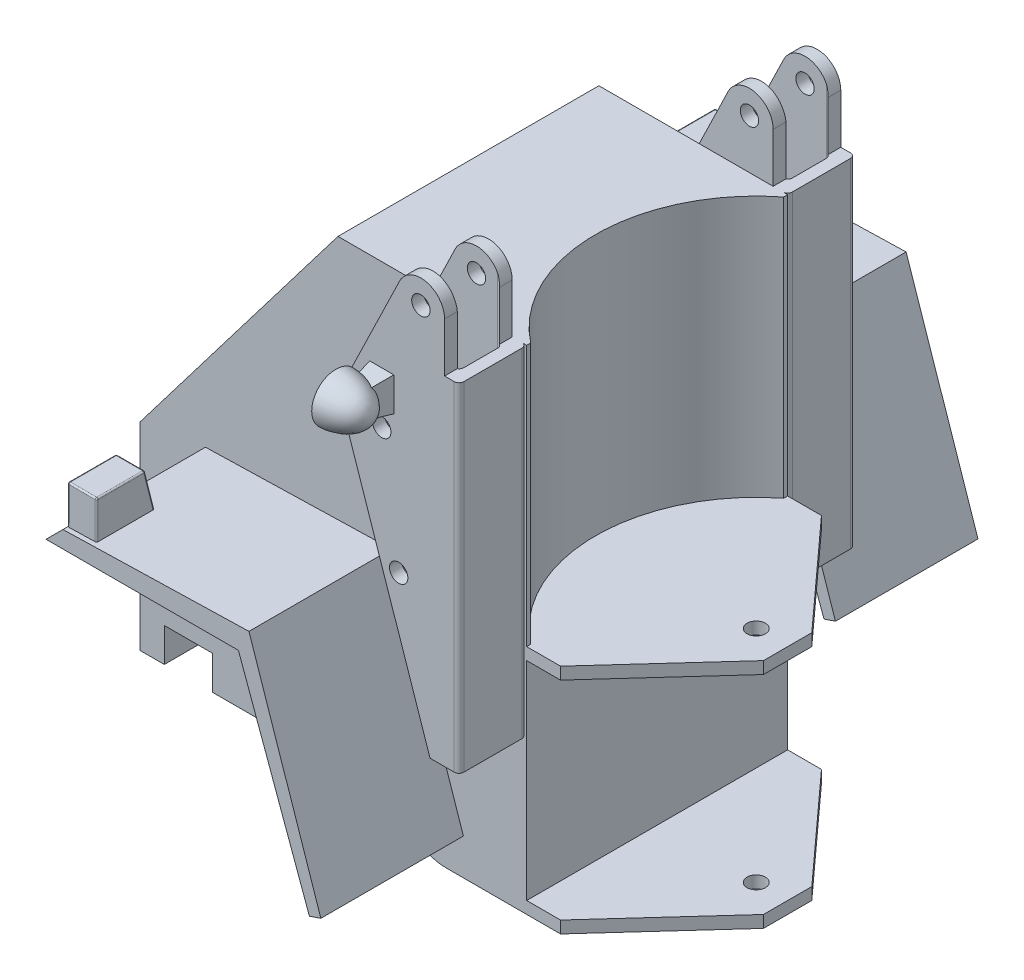
from build123d import *

# Parameters (mm, degrees)
BOSS_EXTRUDE1_DEPTH      = 13.5
SKETCH2_R                = 16.625
CUT_EXTRUDE1_DEPTH       = 27
SKETCH3_R                = 0.95
BOSS_EXTRUDE2_DEPTH      = 7
SKETCH4_W                = 10.661192755
SKETCH4_H                = 4.5
CUT_EXTRUDE2_DEPTH       = 71.961897113
SKETCH5_W                = 5
SKETCH5_H                = 3.5
CUT_EXTRUDE3_DEPTH       = 74.104998747
CUT_EXTRUDE4_REACH       = 72.962
FILLET1_R                = 10
FILLET2_R                = 0.5
CUT_EXTRUDE5_DEPTH       = 35
BOSS_EXTRUDE3_DEPTH      = 13.5
BOSS_EXTRUDE3_DEPTH_BACK = 1.25
BOSS_EXTRUDE4_DEPTH      = 3
CUT_EXTRUDE6_DEPTH       = 0.1
FILLET3_R                = 0.15
SKETCH11_W               = 2.5
SKETCH11_H               = 3.5
BOSS_EXTRUDE5_DEPTH      = 4
BOSS_EXTRUDE5_TAPER      = 10
FILLET2_OF_MIRROR5_R     = 0.5
SKETCH17_R               = 0.95
BOSS_EXTRUDE6_DEPTH      = 1.25
BOSS_EXTRUDE7_START      = -1.25
SKETCH18_R               = 0.95
BOSS_EXTRUDE7_DEPTH      = 1.25
FILLET4_R                = 5
BOSS_EXTRUDE8_REACH      = 81.293
SKETCH19_R               = 3
FILLET5_R                = 1
BOSS_EXTRUDE9_DEPTH      = 27


# Read off the part's stored shape, not the designer's step: Dome1, Dome2
with BuildPart() as part:
    # Sketch1 → Boss-Extrude1 (new, symmetric)
    with BuildSketch(Plane.XY):
        Polygon((0, 0), (0, 8), (30, 47.35), (40, 47.35), (40, -3.65), (31, -3.65), (18, 0), align=None)
    extrude(amount=BOSS_EXTRUDE1_DEPTH, both=True)

    # Sketch2 → Cut-Extrude1 (cut)
    with BuildSketch(Plane(origin=(0, 47.35, 0), x_dir=(1, 0, 0), z_dir=(0, 1, 0))):
        with Locations((50.25, 0)):
            Circle(SKETCH2_R)
    extrude(amount=-CUT_EXTRUDE1_DEPTH, mode=Mode.SUBTRACT)

    # Sketch3 → Boss-Extrude2 (add)
    with BuildSketch(Plane.XY.offset(13.5)):
        with BuildLine():
            Line((40, 47.35), (38.5, 47.35))
            Line((38.5, 47.35), (38.5, 52.462119262))
            ThreePointArc((38.5, 52.462119262), (36.598202136, 54.85), (33.845327005, 53.530724422))
            Line((33.845327005, 53.530724422), (28.839808282, 43.203680936))
            ThreePointArc((28.839808282, 43.203680936), (28.103498823, 40.401650451), (28.484133975, 37.529605301))
            Line((28.484133975, 37.529605301), (37, 12.35))
            Line((37, 12.35), (40, 12.35))
            Line((40, 12.35), (40, 47.35))
        make_face()
        with Locations((36.05, 52.462119262)):
            Circle(SKETCH3_R, mode=Mode.SUBTRACT)
        with Locations((32, 39.532440652)):
            Circle(SKETCH3_R, mode=Mode.SUBTRACT)
        with Locations((33.75, 27.35)):
            Circle(SKETCH3_R, mode=Mode.SUBTRACT)
    boss_extrude2 = extrude(amount=BOSS_EXTRUDE2_DEPTH)

    # Sketch4 → Cut-Extrude2 (cut, through all)
    with BuildSketch(Plane(origin=(0, 0, 0), x_dir=(1, 0, 0), z_dir=(0, 1, 0))):
        with Locations((33.419403622, -17)):
            Rectangle(SKETCH4_W, SKETCH4_H)
    cut_extrude2 = extrude(amount=CUT_EXTRUDE2_DEPTH, mode=Mode.SUBTRACT)

    # Sketch5 → Cut-Extrude3 (cut, through all)
    with BuildSketch(Plane.XY.offset(13.5)):
        with Locations((5, 1.75)):
            Rectangle(SKETCH5_W, SKETCH5_H)
    extrude(amount=-CUT_EXTRUDE3_DEPTH, mode=Mode.SUBTRACT)

    # Cut-Extrude4: up to this face of the body (flat: up to its plane)
    cut_extrude4_end = Plane(part.part.faces().sort_by_distance((7.5, 1.75, 0))[0])
    # Sketch6 → Cut-Extrude4 (cut, up to the picked face)
    with BuildSketch(Plane.ZY, mode=Mode.PRIVATE) as cut_extrude4_sk1:
        with BuildLine():
            Line((-7.5, 0), (7.5, 0))
            ThreePointArc((7.5, 0), (0, 7.5), (-7.5, 0))
        make_face()
    cut_extrude4_tool1 = split(extrude(cut_extrude4_sk1.sketch, amount=-CUT_EXTRUDE4_REACH, mode=Mode.PRIVATE), bisect_by=cut_extrude4_end, keep=Keep.BOTH, mode=Mode.PRIVATE)
    add(cut_extrude4_tool1.solids().sort_by(Axis((0, 3.183099, 0), (1, 0, 0)))[0], mode=Mode.SUBTRACT)

    # Fillet1
    fillet1_edges = [part.edges().sort_by_distance(p)[0] for p in [
        (5, 3.5, -6.633249581),
        (5, 3.5, 6.633249581),
    ]]
    fillet(fillet1_edges, radius=FILLET1_R)

    # Fillet2
    fillet2_edges = [part.edges().sort_by_distance(p)[0] for p in [
        (40, 29.85, 20.5),
        (38.75, 29.85, 19.25),
        (38.75, 29.85, 14.75),
    ]]
    fillet(fillet2_edges, radius=FILLET2_R)

    # Sketch7 → Cut-Extrude5 (cut)
    with BuildSketch(Plane(origin=(0, 47.35, 0), x_dir=(1, 0, 0), z_dir=(0, 1, 0))):
        with BuildLine():
            Line((39.5, -13.5), (40, -13.5))
            Line((40, -13.5), (40, -14))
            ThreePointArc((40, -14), (39.853553391, -13.646446609), (39.5, -13.5))
        make_face()
    cut_extrude5 = extrude(amount=-CUT_EXTRUDE5_DEPTH, mode=Mode.SUBTRACT)

    # Sketch11 → Boss-Extrude5 (add)
    with BuildSketch(Plane.XY.offset(20.5)):
        with Locations((32, 43.082440652)):
            Rectangle(SKETCH11_W, SKETCH11_H)
    boss_extrude5 = extrude(amount=BOSS_EXTRUDE5_DEPTH, taper=BOSS_EXTRUDE5_TAPER)

    # Sketch14 → Revolve1 (revolve)
    with BuildSketch(Plane.XZ.offset(-43.082440652)):
        with BuildLine():
            Line((30.502864053, 23.75), (34.252864053, 23.75))
            add(Edge.make_bspline(
                [(30.502864053, 21.25), (31.668412022, 21.25), (34.252864053, 21.919443705), (34.252864053, 23.75)],
                knots=[0, 0, 0, 0, 1, 1, 1, 1], degree=3))
            Line((30.502864053, 21.25), (30.502864053, 23.75))
        make_face()
    revolve1 = revolve(axis=Axis((30.502864053, 43.082440652, 23.75), (1, 0, 0)))

    # Mirror5: Boss-Extrude2 across plane
    add(boss_extrude2.mirror(Plane.XY))

    # Mirror5 2: Cut-Extrude2, Cut-Extrude5 across plane
    add(cut_extrude2.mirror(Plane.XY), mode=Mode.SUBTRACT)
    add(cut_extrude5.mirror(Plane.XY), mode=Mode.SUBTRACT)

    # Mirror5 3: Boss-Extrude5, Revolve1 across plane
    add(boss_extrude5.mirror(Plane.XY))
    add(revolve1.mirror(Plane.XY))

    # Fillet2 of Mirror5
    fillet2_of_mirror5_edges = [part.edges().sort_by_distance(p)[0] for p in [
        (40, 29.85, -20.5),
        (38.75, 29.85, -19.25),
        (38.75, 29.85, -14.75),
    ]]
    fillet(fillet2_of_mirror5_edges, radius=FILLET2_OF_MIRROR5_R)

    # Dome1 outline → Dome1 (revolve, cut)
    with BuildSketch(Plane(origin=(0, 43.082440652, 23.75), x_dir=(0, 1, 0), z_dir=(0, 0, -1))):
        with BuildLine():
            Line((0, 33.502864053), (0, 30.502864051))
            Line((0, 30.502864051), (1.999999999, 30.502864051))
            ThreePointArc((1.999999999, 30.502864051), (1.802775638, 32.538047811), (0, 33.502864053))
        make_face()
    revolve(axis=Axis((0, 43.082440652, 23.75), (1, 0, 0)), mode=Mode.SUBTRACT)

    # Dome2 outline → Dome2 (revolve, cut)
    with BuildSketch(Plane(origin=(0, 43.082440652, -23.75), x_dir=(0, 1, 0), z_dir=(0, 0, -1))):
        with BuildLine():
            Line((0, 33.502864053), (0, 30.502864051))
            Line((0, 30.502864051), (1.999999999, 30.502864051))
            ThreePointArc((1.999999999, 30.502864051), (1.802775638, 32.538047811), (0, 33.502864053))
        make_face()
    revolve(axis=Axis((0, 43.082440652, -23.75), (1, 0, 0)), mode=Mode.SUBTRACT)


with BuildPart() as body_2:
    # Sketch8 → Boss-Extrude3 (new, two sides: drawn at the far end of the back side and taken through both)
    with BuildSketch(Plane.XY.offset(20.5).offset(-BOSS_EXTRUDE3_DEPTH_BACK)):
        Polygon((31.757823968, 27.85), (12.507823968, 27.35), (10.757823968, 25.6), (30.668099233, 25.6), (38.014219672, 5.449527442), (39.198331884, 5.85), align=None)
    extrude(amount=BOSS_EXTRUDE3_DEPTH + BOSS_EXTRUDE3_DEPTH_BACK)

    # Sketch9 → Boss-Extrude4 (add)
    with BuildSketch(Plane(origin=(12.5, 0, 0), x_dir=(0, 0, -1), z_dir=(1, 0, 0))):
        Polygon((-27.5, 27.35), (-33.5, 27.35), (-33.5, 31.35), (-28.5, 31.35), align=None)
    extrude(amount=BOSS_EXTRUDE4_DEPTH)

    # Sketch10 → Cut-Extrude6 (cut)
    with BuildSketch(Plane.ZY.offset(-12.5)):
        Polygon((33.25, 27.6), (33.25, 31.1), (28.695194102, 31.1), (27.820194102, 27.6), align=None)
    extrude(amount=-CUT_EXTRUDE6_DEPTH, mode=Mode.SUBTRACT)

    # Fillet3
    # the kernel refuses this fillet: 0.15 mm, written as the material it takes off along each edge
    with BuildSketch(Plane(origin=(15.35, 31.2, 33.35), x_dir=(1, 0, 0), z_dir=(0, 1, 0))) as fillet3_piece_1_section:
        Polygon((0, 0), (FILLET3_R, 0), (FILLET3_R, -FILLET3_R), (0, -FILLET3_R), align=None)
    fillet3_piece_1 = extrude(amount=FILLET3_R, mode=Mode.PRIVATE)
    fillet3_piece_1 = fillet3_piece_1 - Plane(origin=(15.35, 31.2, 33.35), x_dir=(-0.7071067811865475, 0, -0.7071067811865475), z_dir=(0, 1, 0)) * Sphere(FILLET3_R, mode=Mode.PRIVATE)
    add(fillet3_piece_1, mode=Mode.SUBTRACT)
    with BuildSketch(Plane(origin=(15.35, 31.2, 28.617116461), x_dir=(0, 1, 0), z_dir=(1, 0, 0))) as fillet3_piece_2_section:
        Polygon((0, 0), (FILLET3_R, 0), (FILLET3_R, -FILLET3_R * 0.780776406404), (FILLET3_R * 0.242535625036, -FILLET3_R * 0.970142500145), align=None)
    fillet3_piece_2 = extrude(amount=FILLET3_R, mode=Mode.PRIVATE)
    fillet3_piece_2 = fillet3_piece_2 - Plane(origin=(15.35, 31.2, 28.617116461), x_dir=(0, -0.788205438016109, 0.615412209402636), z_dir=(1, 0, 0)) * Sphere(FILLET3_R, mode=Mode.PRIVATE)
    add(fillet3_piece_2, mode=Mode.SUBTRACT)
    with BuildSketch(Plane(origin=(12.65, 31.2, 28.617116461), x_dir=(0, 0.24253562503633236, -0.9701425001453321), z_dir=(-1, 0, 0))) as fillet3_piece_3_section:
        Polygon((0, 0), (FILLET3_R, 0), (FILLET3_R, -FILLET3_R * 0.780776406404), (FILLET3_R * 0.242535625036, -FILLET3_R * 0.970142500145), align=None)
    fillet3_piece_3 = extrude(amount=FILLET3_R, mode=Mode.PRIVATE)
    fillet3_piece_3 = fillet3_piece_3 - Plane(origin=(12.65, 31.2, 28.617116461), x_dir=(0, -0.788205438016109, 0.615412209402636), z_dir=(-1, 0, 0)) * Sphere(FILLET3_R, mode=Mode.PRIVATE)
    add(fillet3_piece_3, mode=Mode.SUBTRACT)
    with BuildSketch(Plane(origin=(12.65, 31.2, 33.35), x_dir=(0, 1, 0), z_dir=(-1, 0, 0))) as fillet3_piece_4_section:
        Polygon((0, 0), (FILLET3_R, 0), (FILLET3_R, -FILLET3_R), (0, -FILLET3_R), align=None)
    fillet3_piece_4 = extrude(amount=FILLET3_R, mode=Mode.PRIVATE)
    fillet3_piece_4 = fillet3_piece_4 - Plane(origin=(12.65, 31.2, 33.35), x_dir=(0, -0.7071067811865475, -0.7071067811865475), z_dir=(-1, 0, 0)) * Sphere(FILLET3_R, mode=Mode.PRIVATE)
    add(fillet3_piece_4, mode=Mode.SUBTRACT)
    with BuildSketch(Plane(origin=(15.5, 31.35, 33.35), x_dir=(0, -1, 0), z_dir=(0, 0, -1))) as fillet3_piece_5:
        with BuildLine():
            CenterArc((FILLET3_R, FILLET3_R), FILLET3_R, 180, 90)
            Line((0, FILLET3_R), (0, 0))
            Line((0, 0), (FILLET3_R, 0))
        make_face()
    extrude(amount=4.732883539, mode=Mode.SUBTRACT)
    with BuildSketch(Plane(origin=(15.5, 31.236380344, 28.471595086), x_dir=(-1, 0, 0), z_dir=(0, -0.9701425001453321, -0.24253562503633236))) as fillet3_piece_6_section:
        with BuildLine():
            CenterArc((FILLET3_R, -FILLET3_R), FILLET3_R, 90, 90)
            Line((0, -FILLET3_R), (0, 0))
            Line((0, 0), (FILLET3_R, 0))
        make_face()
    fillet3_piece_6 = extrude(amount=4.3008784, mode=Mode.PRIVATE)
    fillet3_piece_6 = split(fillet3_piece_6, bisect_by=Plane(origin=(15.515328753, 27.428117007, 28.029305887), z_dir=(-0.025965268716199853, 0.9996628455736942, 0)), keep=Keep.TOP, mode=Mode.PRIVATE)
    add(fillet3_piece_6, mode=Mode.SUBTRACT)
    with BuildSketch(Plane(origin=(15.5, 27.052718858, 33.5), x_dir=(0, 0, -1), z_dir=(0, 1, 0))) as fillet3_piece_7_section:
        with BuildLine():
            CenterArc((FILLET3_R, FILLET3_R), FILLET3_R, 180, 90)
            Line((0, FILLET3_R), (0, 0))
            Line((0, 0), (FILLET3_R, 0))
        make_face()
    fillet3_piece_7 = extrude(amount=4.147281142, mode=Mode.PRIVATE)
    fillet3_piece_7 = split(fillet3_piece_7, bisect_by=Plane(origin=(15.515002619, 27.428108536, 33.466044985), z_dir=(-0.025965268716199853, 0.9996628455736942, 0)), keep=Keep.TOP, mode=Mode.PRIVATE)
    add(fillet3_piece_7, mode=Mode.SUBTRACT)
    with BuildSketch(Plane(origin=(12.65, 31.35, 28.5), x_dir=(0, -0.9701425001453301, -0.2425356250363401), z_dir=(1, 0, 0))) as fillet3_piece_8:
        with BuildLine():
            CenterArc((FILLET3_R * 0.780776406404, -FILLET3_R), FILLET3_R, 90, 75.963756532)
            Line((-FILLET3_R * 0.189366093741, -FILLET3_R * 0.757464374964), (0, 0))
            Line((0, 0), (FILLET3_R * 0.780776406404, 0))
        make_face()
    extrude(amount=2.7, mode=Mode.SUBTRACT)
    with BuildSketch(Plane(origin=(12.5, 31.236380344, 28.471595086), x_dir=(1, 0, 0), z_dir=(0, -0.9701425001453321, -0.24253562503633236))) as fillet3_piece_9_section:
        with BuildLine():
            CenterArc((FILLET3_R, FILLET3_R), FILLET3_R, 180, 90)
            Line((0, FILLET3_R), (0, 0))
            Line((0, 0), (FILLET3_R, 0))
        make_face()
    fillet3_piece_9 = extrude(amount=4.380989165, mode=Mode.PRIVATE)
    fillet3_piece_9 = split(fillet3_piece_9, bisect_by=Plane(origin=(12.584313827, 27.35198675, 28.01979607), z_dir=(-0.025965268716199853, 0.9996628455736942, 0)), keep=Keep.TOP, mode=Mode.PRIVATE)
    add(fillet3_piece_9, mode=Mode.SUBTRACT)
    with BuildSketch(Plane(origin=(12.65, 31.35, 33.5), x_dir=(0, -1, 0), z_dir=(1, 0, 0))) as fillet3_piece_10:
        with BuildLine():
            CenterArc((FILLET3_R, FILLET3_R), FILLET3_R, 180, 90)
            Line((0, FILLET3_R), (0, 0))
            Line((0, 0), (FILLET3_R, 0))
        make_face()
    extrude(amount=2.7, mode=Mode.SUBTRACT)
    with BuildSketch(Plane(origin=(12.5, 31.35, 33.35), x_dir=(0, -1, 0), z_dir=(0, 0, -1))) as fillet3_piece_11:
        with BuildLine():
            CenterArc((FILLET3_R, -FILLET3_R), FILLET3_R, 90, 90)
            Line((0, -FILLET3_R), (0, 0))
            Line((0, 0), (FILLET3_R, 0))
        make_face()
    extrude(amount=4.732883539, mode=Mode.SUBTRACT)
    with BuildSketch(Plane(origin=(12.5, 26.975, 33.5), x_dir=(1, 0, 0), z_dir=(0, 1, 0))) as fillet3_piece_12_section:
        with BuildLine():
            CenterArc((FILLET3_R, FILLET3_R), FILLET3_R, 180, 90)
            Line((0, FILLET3_R), (0, 0))
            Line((0, 0), (FILLET3_R, 0))
        make_face()
    fillet3_piece_12 = extrude(amount=4.225, mode=Mode.PRIVATE)
    fillet3_piece_12 = split(fillet3_piece_12, bisect_by=Plane(origin=(12.583909693, 27.351976253, 33.466036564), z_dir=(-0.025965268716199853, 0.9996628455736942, 0)), keep=Keep.TOP, mode=Mode.PRIVATE)
    add(fillet3_piece_12, mode=Mode.SUBTRACT)


with BuildPart() as body_3:
    # Mirror4: mirrored copy
    add(body_2.part.mirror(Plane.XY))


with BuildPart() as part_1:
    add(part.part)

    # Combine1: union body 2, body 3
    add(body_2.part)
    add(body_3.part)

    # Sketch17 → Boss-Extrude6 (add)
    with BuildSketch(Plane.XZ.offset(3.65)):
        Polygon((40, -13.5), (43.5, -13.5), (53.5, -2.5), (53.5, 2.5), (43.5, 13.5), (40, 13.5), align=None)
        with Locations((50.25, 0)):
            Circle(SKETCH17_R, mode=Mode.SUBTRACT)
    extrude(amount=-BOSS_EXTRUDE6_DEPTH)

    # Sketch18 → Boss-Extrude7 (add)
    with BuildSketch(Plane(origin=(0, 20.35, 0), x_dir=(1, 0, 0), z_dir=(0, 1, 0)).offset(BOSS_EXTRUDE7_START)):
        Polygon((43.5, 13.5), (40, 13.5), (40, -13.5), (43.5, -13.5), (53.5, -2.5), (53.5, 2.5), align=None)
        with Locations((50.25, 0)):
            Circle(SKETCH18_R, mode=Mode.SUBTRACT)
    extrude(amount=BOSS_EXTRUDE7_DEPTH)

    # Fillet4
    fillet4_edges = [part_1.edges().sort_by_distance(p)[0] for p in [
        (31, -3.65, 0),
        (18, 0, 0),
    ]]
    fillet(fillet4_edges, radius=FILLET4_R)

    # Sketch19 → Boss-Extrude8 (add, up to next)
    with BuildSketch(Plane.ZY.offset(-7.5), mode=Mode.PRIVATE) as boss_extrude8_sk1:
        Circle(SKETCH19_R)
    boss_extrude8_tool1 = extrude(boss_extrude8_sk1.sketch, amount=-BOSS_EXTRUDE8_REACH, mode=Mode.PRIVATE) - part_1.part
    add(boss_extrude8_tool1.solids().sort_by_distance((7.5, 0, 0))[0])

    # Fillet5
    fillet5_edges = [part_1.edges().sort_by_distance(p)[0] for p in [
        (12.405695262, 0, -3),
        (17.993574467, -0.046756107, -2.999635625),
        (28.6849033, -2.99999208, -0.006893324),
        (17.993574467, -0.046756107, 2.999635625),
        (12.405695262, 0, 3),
    ]]
    fillet(fillet5_edges, radius=FILLET5_R)

    # Sketch20 → Boss-Extrude9 (add)
    with BuildSketch(Plane.XY.offset(13.5)):
        Polygon((0, 8), (0, 20.5), (20.470139771, 47.35), (30, 47.35), align=None)
    extrude(amount=-BOSS_EXTRUDE9_DEPTH)


solid = part_1.part
